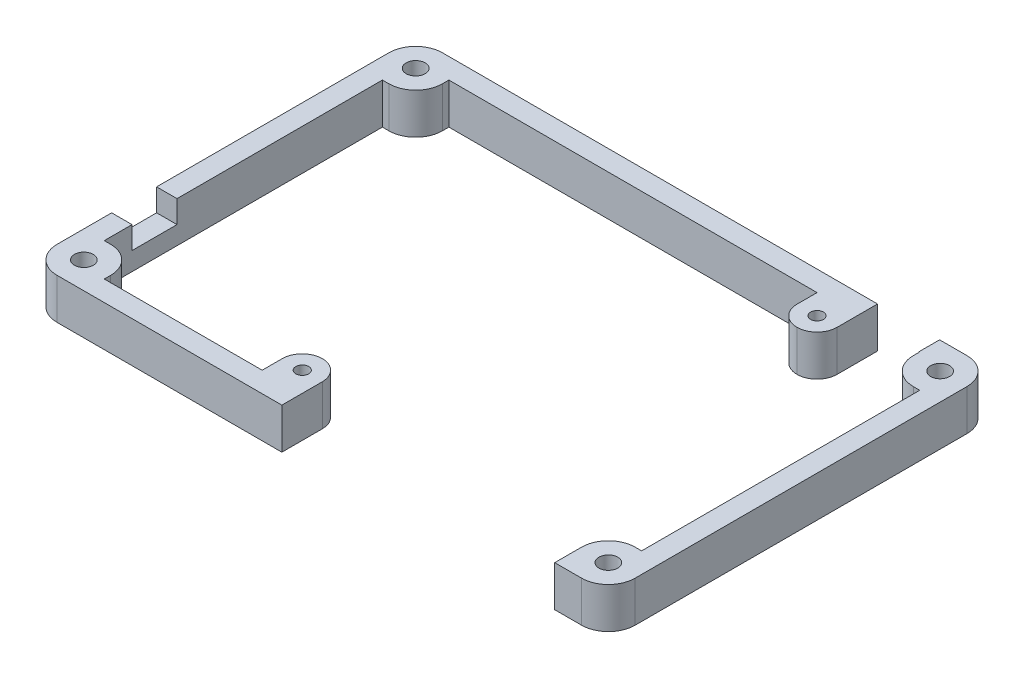
from build123d import *

# Parameters (mm, degrees)
BOSS_EXTRUDE3_DEPTH = 6.35
SKETCH3_W           = 9.663283239
SKETCH3_H           = 6.35
CUT_EXTRUDE1_DEPTH  = 3.175
SKETCH4_W           = 42.475
SKETCH4_H           = 6.35
CUT_EXTRUDE2_DEPTH  = 8.35
SKETCH5_W           = 7
SKETCH5_H           = 7
CUT_EXTRUDE3_DEPTH  = 3.175
SKETCH7_R           = 1.4732
CUT_EXTRUDE4_DEPTH  = 10
SKETCH10_W          = 6.24
SKETCH10_H          = 6.35
BOSS_EXTRUDE4_DEPTH = 6.24
SKETCH11_W          = 6.24
SKETCH11_H          = 6.35
BOSS_EXTRUDE5_DEPTH = 6.24
SKETCH12_R          = 1
CUT_EXTRUDE5_DEPTH  = 55.454774814
SKETCH13_R          = 1
CUT_EXTRUDE6_DEPTH  = 55.454774814
FILLET1_R           = 3.12


with BuildPart() as part:
    # Sketch2 → Boss-Extrude3 (new body)
    with BuildSketch(Plane(origin=(0, 0, 0), x_dir=(1, 0, 0), z_dir=(0, 1, 0))):
        with BuildLine():
            Line((-45, 25.825), (-45, -25.825))
            ThreePointArc((-45, -25.825), (-43.777170811, -28.777170811), (-40.825, -30))
            Line((-40.825, -30), (40.825, -30))
            ThreePointArc((40.825, -30), (43.777170811, -28.777170811), (45, -25.825))
            Line((45, -25.825), (45, 25.825))
            ThreePointArc((45, 25.825), (43.777170811, 28.777170811), (40.825, 30))
            Line((40.825, 30), (-40.825, 30))
            ThreePointArc((-40.825, 30), (-43.777170811, 28.777170811), (-45, 25.825))
        make_face()
        with BuildLine():
            Line((40.825, 21.65), (41.825, 21.65))
            Line((41.825, 21.65), (41.825, -21.65))
            Line((41.825, -21.65), (40.825, -21.65))
            ThreePointArc((40.825, -21.65), (37.872829189, -22.872829189), (36.65, -25.825))
            Line((36.65, -25.825), (36.65, -26.825))
            Line((36.65, -26.825), (-36.65, -26.825))
            Line((-36.65, -26.825), (-36.65, -25.825))
            ThreePointArc((-36.65, -25.825), (-37.872829189, -22.872829189), (-40.825, -21.65))
            Line((-40.825, -21.65), (-41.825, -21.65))
            Line((-41.825, -21.65), (-41.825, 21.65))
            Line((-41.825, 21.65), (-40.825, 21.65))
            ThreePointArc((-40.825, 21.65), (-37.872829189, 22.872829189), (-36.65, 25.825))
            Line((-36.65, 25.825), (-36.65, 26.825))
            Line((-36.65, 26.825), (36.65, 26.825))
            Line((36.65, 26.825), (36.65, 25.825))
            ThreePointArc((36.65, 25.825), (37.872829189, 22.872829189), (40.825, 21.65))
        make_face(mode=Mode.SUBTRACT)
    extrude(amount=BOSS_EXTRUDE3_DEPTH)

    # Sketch3 → Cut-Extrude1 (cut)
    with BuildSketch(Plane(origin=(0, 0, -30), x_dir=(-1, 0, 0), z_dir=(0, 0, -1))):
        with Locations((-31.734329903, 3.175)):
            Rectangle(SKETCH3_W, SKETCH3_H)
    extrude(amount=-CUT_EXTRUDE1_DEPTH, mode=Mode.SUBTRACT)

    # Sketch4 → Cut-Extrude2 (cut)
    with BuildSketch(Plane.XY.offset(30)):
        with Locations((15.4125, 3.175)):
            Rectangle(SKETCH4_W, SKETCH4_H)
    extrude(amount=-CUT_EXTRUDE2_DEPTH, mode=Mode.SUBTRACT)


with BuildPart() as cut_extrude2_piece_1:
    # of the separate pieces the step leaves, piece 1, a body of its own (cut_extrude2_pieces)
    add(part.part.solids().sort_by_distance((-40.825, 0, 30))[0])

    # Sketch5 → Cut-Extrude3 (cut)
    with BuildSketch(Plane.ZY.offset(45)):
        with Locations((13.825, 6.35)):
            Rectangle(SKETCH5_W, SKETCH5_H)
    extrude(amount=-CUT_EXTRUDE3_DEPTH, mode=Mode.SUBTRACT)


with BuildPart() as cut_extrude2_piece_2:
    # of the separate pieces the step leaves, piece 2, a body of its own (cut_extrude2_pieces)
    add(part.part.solids().sort_by_distance((40.825, 0, -30))[0])


with BuildPart() as cut_extrude4_tool:
    # Sketch7 → Cut-Extrude4 (new body)
    with BuildSketch(Plane.XZ):
        with Locations(Location((-40.825, -25.825, 0), (0, 0, 270))):
            Circle(SKETCH7_R)
        with Locations(Location((-40.825, 25.825, 0), (0, 0, 270))):
            Circle(SKETCH7_R)
        with Locations(Location((40.825, 25.825, 0), (0, 0, 270))):
            Circle(SKETCH7_R)
        with Locations(Location((40.825, -25.825, 0), (0, 0, 270))):
            Circle(SKETCH7_R)
    extrude(amount=-CUT_EXTRUDE4_DEPTH)


with BuildPart() as cut_extrude2_piece_1_1:
    add(cut_extrude2_piece_1.part)

    # Cut-Extrude4: cut by cut_extrude4_tool
    add(cut_extrude4_tool.part, mode=Mode.SUBTRACT)

    # Sketch10 → Boss-Extrude4 (add)
    with BuildSketch(Plane(origin=(0, 0, 26.825), x_dir=(-1, 0, 0), z_dir=(0, 0, -1))):
        with Locations((8.945, 3.175)):
            Rectangle(SKETCH10_W, SKETCH10_H)
    extrude(amount=BOSS_EXTRUDE4_DEPTH)

    # Sketch11 → Boss-Extrude5 (add)
    with BuildSketch(Plane.XY.offset(-26.825)):
        with Locations((23.782688283, 3.175)):
            Rectangle(SKETCH11_W, SKETCH11_H)
    extrude(amount=BOSS_EXTRUDE5_DEPTH)

    # Sketch12 → Cut-Extrude5 (cut, through all)
    with BuildSketch(Plane(origin=(0, 6.35, 0), x_dir=(1, 0, 0), z_dir=(0, 1, 0))):
        with Locations(Location((23.782688283, 23.705, 0), (0, 0, 270))):
            Circle(SKETCH12_R)
    extrude(amount=-CUT_EXTRUDE5_DEPTH, mode=Mode.SUBTRACT)

    # Sketch13 → Cut-Extrude6 (cut, through all)
    with BuildSketch(Plane(origin=(0, 6.35, 0), x_dir=(1, 0, 0), z_dir=(0, 1, 0))):
        with Locations(Location((-8.945, -23.705, 0), (0, 0, 270))):
            Circle(SKETCH13_R)
    extrude(amount=-CUT_EXTRUDE6_DEPTH, mode=Mode.SUBTRACT)

    # Fillet1
    fillet1_edges = [cut_extrude2_piece_1_1.edges().sort_by_distance(p)[0] for p in [
        (26.902688283, 3.175, -20.585),
        (20.662688283, 3.175, -20.585),
        (-5.825, 3.175, 20.585),
        (-12.065, 3.175, 20.585),
    ]]
    fillet(fillet1_edges, radius=FILLET1_R - 0.0001)  # a hair under: the kernel refuses the full size


with BuildPart() as cut_extrude2_piece_2_1:
    add(cut_extrude2_piece_2.part)

    # Cut-Extrude4: cut by cut_extrude4_tool
    add(cut_extrude4_tool.part, mode=Mode.SUBTRACT)


solid = Compound([cut_extrude2_piece_1_1.part, cut_extrude2_piece_2_1.part])
